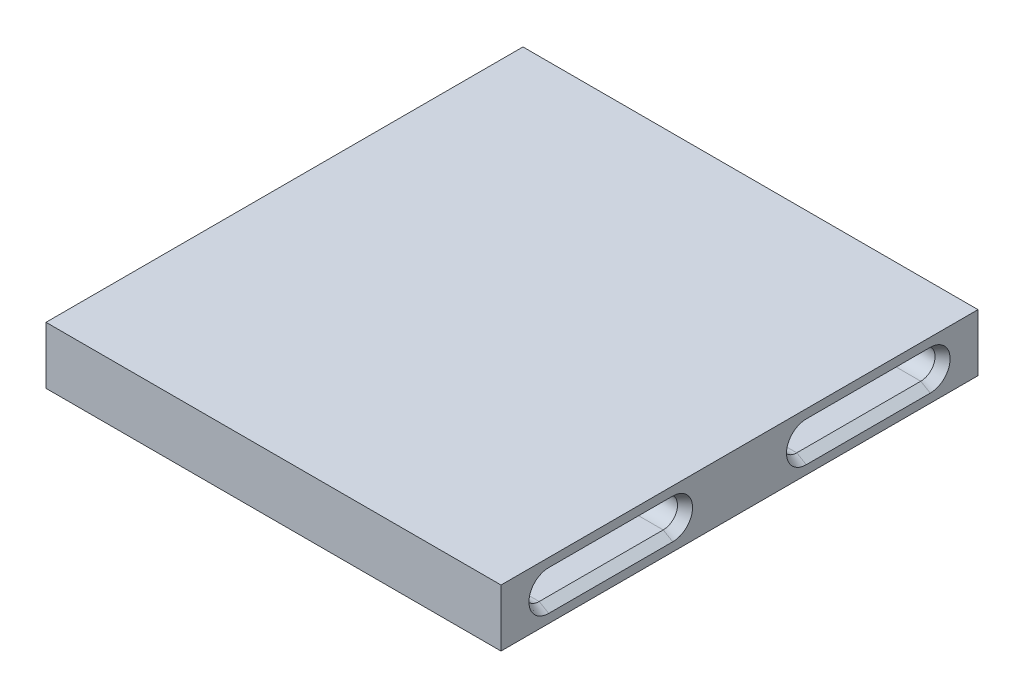
from build123d import *
from OCP.BRepFilletAPI import BRepFilletAPI_MakeChamfer
from build123d.topology import SkipClean

# Parameters (mm, degrees)
SKETCH1_W               = 25
SKETCH1_H               = 3
BOSS_EXTRUDE1_DEPTH     = 23.85
CUT_EXTRUDE1_DEPTH      = 27.968917294
CUT_EXTRUDE1_DEPTH_BACK = 27.968917294
SKETCH3_R               = 1.05
CUT_EXTRUDE2_DEPTH      = 10
CHAMFER1_SIZE           = 0.5
CHAMFER1_SIZE2          = 0.288675135
THREAD1_PITCH           = 0.4


with BuildPart() as part:
    # Sketch1 → Boss-Extrude1 (new body)
    with BuildSketch(Plane(origin=(0, 0, 0), x_dir=(0, 0, -1), z_dir=(1, 0, 0))):
        Rectangle(SKETCH1_W, SKETCH1_H)
    extrude(amount=BOSS_EXTRUDE1_DEPTH)

    # Sketch2 → Cut-Extrude1 (cut, two sides: drawn at the far end of the back side and taken through both)
    with BuildSketch(Plane.ZY.offset(-CUT_EXTRUDE1_DEPTH_BACK)):
        with BuildLine():
            Line((-10, 0.75), (-3.5, 0.75))
            ThreePointArc((-3.5, 0.75), (-2.75, 0), (-3.5, -0.75))
            Line((-3.5, -0.75), (-10, -0.75))
            ThreePointArc((-10, -0.75), (-10.75, 0), (-10, 0.75))
        make_face()
        with BuildLine():
            Line((3.5, 0.75), (10, 0.75))
            ThreePointArc((10, 0.75), (10.75, 0), (10, -0.75))
            Line((10, -0.75), (3.5, -0.75))
            ThreePointArc((3.5, -0.75), (2.75, 0), (3.5, 0.75))
        make_face()
    extrude(amount=CUT_EXTRUDE1_DEPTH + CUT_EXTRUDE1_DEPTH_BACK, mode=Mode.SUBTRACT)

    # Sketch3 → Cut-Extrude2 (cut)
    with BuildSketch(Plane.ZY):
        Circle(SKETCH3_R)
    extrude(amount=-CUT_EXTRUDE2_DEPTH, mode=Mode.SUBTRACT)

    # Chamfer1: one chamfer whose edges measure the first distance from different faces: ONE call of the kernel's chamfer builder (chamfer() names one face for all edges)
    chamfer1_edges_1 = [part.edges().sort_by_distance(p)[0] for p in [
        (23.85, 0, -10.75),
    ]]
    chamfer1_side_1 = [part.faces().sort_by_distance(p)[0] for p in [
        (11.925, 0, -10.75),
    ]]
    chamfer1_edges_2 = [part.edges().sort_by_distance(p)[0] for p in [
        (23.85, 0.75, -6.75),
    ]]
    chamfer1_side_2 = [part.faces().sort_by_distance(p)[0] for p in [
        (11.925, 0.75, -6.75),
    ]]
    chamfer1_edges_3 = [part.edges().sort_by_distance(p)[0] for p in [
        (23.85, 0, -2.75),
    ]]
    chamfer1_side_3 = [part.faces().sort_by_distance(p)[0] for p in [
        (11.925, 0, -2.75),
    ]]
    chamfer1_edges_4 = [part.edges().sort_by_distance(p)[0] for p in [
        (23.85, -0.75, -6.75),
    ]]
    chamfer1_side_4 = [part.faces().sort_by_distance(p)[0] for p in [
        (11.925, -0.75, -6.75),
    ]]
    chamfer1_edges_5 = [part.edges().sort_by_distance(p)[0] for p in [
        (23.85, 0, 2.75),
    ]]
    chamfer1_side_5 = [part.faces().sort_by_distance(p)[0] for p in [
        (11.925, 0, 2.75),
    ]]
    chamfer1_edges_6 = [part.edges().sort_by_distance(p)[0] for p in [
        (23.85, 0.75, 6.75),
    ]]
    chamfer1_side_6 = [part.faces().sort_by_distance(p)[0] for p in [
        (11.925, 0.75, 6.75),
    ]]
    chamfer1_edges_7 = [part.edges().sort_by_distance(p)[0] for p in [
        (23.85, 0, 10.75),
    ]]
    chamfer1_side_7 = [part.faces().sort_by_distance(p)[0] for p in [
        (11.925, 0, 10.75),
    ]]
    chamfer1_edges_8 = [part.edges().sort_by_distance(p)[0] for p in [
        (23.85, -0.75, 6.75),
    ]]
    chamfer1_side_8 = [part.faces().sort_by_distance(p)[0] for p in [
        (11.925, -0.75, 6.75),
    ]]
    chamfer1 = BRepFilletAPI_MakeChamfer(part.part.solid().wrapped)
    for e in chamfer1_edges_1:
        chamfer1.Add(CHAMFER1_SIZE, CHAMFER1_SIZE2, e.wrapped, chamfer1_side_1[0].wrapped)  # the first distance lies on this face
    for e in chamfer1_edges_2:
        chamfer1.Add(CHAMFER1_SIZE, CHAMFER1_SIZE2, e.wrapped, chamfer1_side_2[0].wrapped)  # the first distance lies on this face
    for e in chamfer1_edges_3:
        chamfer1.Add(CHAMFER1_SIZE, CHAMFER1_SIZE2, e.wrapped, chamfer1_side_3[0].wrapped)  # the first distance lies on this face
    for e in chamfer1_edges_4:
        chamfer1.Add(CHAMFER1_SIZE, CHAMFER1_SIZE2, e.wrapped, chamfer1_side_4[0].wrapped)  # the first distance lies on this face
    for e in chamfer1_edges_5:
        chamfer1.Add(CHAMFER1_SIZE, CHAMFER1_SIZE2, e.wrapped, chamfer1_side_5[0].wrapped)  # the first distance lies on this face
    for e in chamfer1_edges_6:
        chamfer1.Add(CHAMFER1_SIZE, CHAMFER1_SIZE2, e.wrapped, chamfer1_side_6[0].wrapped)  # the first distance lies on this face
    for e in chamfer1_edges_7:
        chamfer1.Add(CHAMFER1_SIZE, CHAMFER1_SIZE2, e.wrapped, chamfer1_side_7[0].wrapped)  # the first distance lies on this face
    for e in chamfer1_edges_8:
        chamfer1.Add(CHAMFER1_SIZE, CHAMFER1_SIZE2, e.wrapped, chamfer1_side_8[0].wrapped)  # the first distance lies on this face
    add(Compound.cast(chamfer1.Shape()), mode=Mode.REPLACE)

    # Thread1: the profile of Thread Profile2 profile screwed along a right-hand helix of 25 turns, 6 arcs to a turn; built about Z, then put on its axis
    with SkipClean():  # the faces are left unmerged after this step: merging them gives an invalid solid
        thread1_z = Axis((0, 0, 0), (0, 0, 1))
        thread1_corners = [(1.0497, 0, -0.000173205), (1.26650635, 0, 0.124999999), (1.26650635, 0, 0.174999999), (1.0497, 0, 0.300173204)]
        with BuildLine(mode=Mode.PRIVATE) as thread1_profile:
            Line(thread1_corners[0], thread1_corners[1])
            Line(thread1_corners[1], thread1_corners[2])
            Line(thread1_corners[2], thread1_corners[3])
            Line(thread1_corners[3], thread1_corners[0])
        thread1_cap = Face(thread1_profile.wire())
        thread1_turn_angles = [0, 30, 60, 90, 120, 150, 180, 210, 240, 270, 300, 330, 360]
        thread1_turn_weights = [1, 0.8660254037844387, 1, 0.8660254037844387, 1, 0.8660254037844387, 1, 0.8660254037844387, 1, 0.8660254037844387, 1, 0.8660254037844387, 1]
        thread1_turn_rails = [Edge.make_bspline([Vector(p[0], p[1], 0).rotate(thread1_z, thread1_turn_angles[k]) / thread1_turn_weights[k] + Vector(0, 0, p[2] + THREAD1_PITCH * thread1_turn_angles[k] / 360) for k in range(13)], [0, 0, 0, 1, 1, 2, 2, 3, 3, 4, 4, 5, 5, 6, 6, 6], 2, thread1_turn_weights) for p in thread1_corners]
        thread1_turn_sides = [Face.make_surface_from_curves(thread1_turn_rails[p[0]], thread1_turn_rails[p[1]]) for p in [(0, 1), (1, 2), (2, 3), (3, 0)]]
        thread1 = Plane(origin=(0, 0, 0), x_dir=(0, 0, -1), z_dir=(1, 0, 0)) * Solid(Shell([*[p.moved(Location((0, 0, THREAD1_PITCH * i))) for i in range(25) for p in thread1_turn_sides], thread1_cap, thread1_cap.rotate(thread1_z, 9000).moved(Location((0, 0, THREAD1_PITCH * 9000 / 360)))]))
        add(thread1, mode=Mode.SUBTRACT)


solid = part.part
